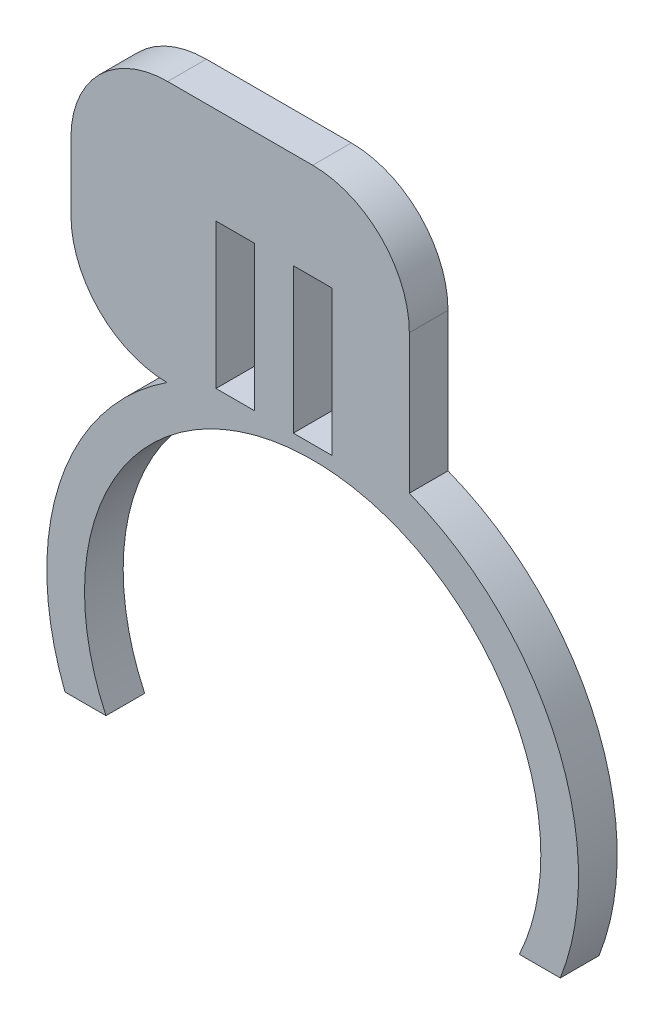
from build123d import *

# Parameters (mm, degrees)
SKETCH1_R           = 34.925
BOSS_EXTRUDE1_DEPTH = 5.08
SKETCH2_W           = 25.4
SKETCH2_H           = 5.08
BOSS_EXTRUDE2_DEPTH = 63.5
SKETCH3_R           = 29.972
CUT_EXTRUDE1_DEPTH  = 50.8
SKETCH4_W           = 5.08
SKETCH4_H           = 19.05
CUT_EXTRUDE2_DEPTH  = 50.8
SKETCH5_W           = 129.040366972
SKETCH5_H           = 73.118289239
CUT_EXTRUDE3_DEPTH  = 50.8
SKETCH6_W           = 5.08
SKETCH6_H           = 34.29
BOSS_EXTRUDE3_DEPTH = 19.05
SKETCH7_W           = 5.08
SKETCH7_H           = 19.05
CUT_EXTRUDE4_DEPTH  = 19.05
FILLET1_R           = 12.7


with BuildPart() as part:
    # Sketch1 → Boss-Extrude1 (new body)
    with BuildSketch(Plane.XY):
        Circle(SKETCH1_R)
    extrude(amount=BOSS_EXTRUDE1_DEPTH)

    # Sketch2 → Boss-Extrude2 (add)
    with BuildSketch(Plane(origin=(0, 0, 0), x_dir=(1, 0, 0), z_dir=(0, 1, 0))):
        with Locations((0, -2.54)):
            Rectangle(SKETCH2_W, SKETCH2_H)
    extrude(amount=BOSS_EXTRUDE2_DEPTH)

    # Sketch3 → Cut-Extrude1 (cut)
    with BuildSketch(Plane(origin=(0, 0, 0), x_dir=(-1, 0, 0), z_dir=(0, 0, -1))):
        Circle(SKETCH3_R)
    extrude(amount=-CUT_EXTRUDE1_DEPTH, mode=Mode.SUBTRACT)

    # Sketch4 → Cut-Extrude2 (cut)
    with BuildSketch(Plane(origin=(0, 0, 0), x_dir=(-1, 0, 0), z_dir=(0, 0, -1))):
        with Locations((0, 41.275)):
            Rectangle(SKETCH4_W, SKETCH4_H)
    extrude(amount=-CUT_EXTRUDE2_DEPTH, mode=Mode.SUBTRACT)

    # Sketch5 → Cut-Extrude3 (cut)
    with BuildSketch(Plane(origin=(0, 0, 0), x_dir=(-1, 0, 0), z_dir=(0, 0, -1))):
        with Locations((0.982448892, -49.25914462)):
            Rectangle(SKETCH5_W, SKETCH5_H)
    extrude(amount=-CUT_EXTRUDE3_DEPTH, mode=Mode.SUBTRACT)

    # Sketch6 → Boss-Extrude3 (add)
    with BuildSketch(Plane.ZY.offset(12.7)):
        with Locations((2.54, 46.355)):
            Rectangle(SKETCH6_W, SKETCH6_H)
    extrude(amount=BOSS_EXTRUDE3_DEPTH)

    # Sketch7 → Cut-Extrude4 (cut)
    with BuildSketch(Plane(origin=(0, 0, 0), x_dir=(-1, 0, 0), z_dir=(0, 0, -1))):
        with Locations((10.16, 41.275)):
            Rectangle(SKETCH7_W, SKETCH7_H)
    extrude(amount=-CUT_EXTRUDE4_DEPTH, mode=Mode.SUBTRACT)

    # Fillet1
    # the kernel refuses this fillet: 12.7 mm, written as the material it takes off along each edge
    with BuildSketch(Plane(origin=(12.7, 63.5, -31.75), x_dir=(-1, 0, 0), z_dir=(0, 0, 1))) as fillet1_piece_1:
        with BuildLine():
            CenterArc((FILLET1_R, FILLET1_R), FILLET1_R, 180, 90)
            Line((0, FILLET1_R), (0, 0))
            Line((0, 0), (FILLET1_R, 0))
        make_face()
    extrude(amount=68.58, mode=Mode.SUBTRACT)
    with BuildSketch(Plane(origin=(-31.75, 63.5, -31.75), x_dir=(1, 0, 0), z_dir=(0, 0, 1))) as fillet1_piece_2:
        with BuildLine():
            CenterArc((FILLET1_R, -FILLET1_R), FILLET1_R, 90, 90)
            Line((0, -FILLET1_R), (0, 0))
            Line((0, 0), (FILLET1_R, 0))
        make_face()
    extrude(amount=68.58, mode=Mode.SUBTRACT)
    with BuildSketch(Plane(origin=(-31.75, 29.21, 36.83), x_dir=(0, 1, 0), z_dir=(0, 0, -1))) as fillet1_piece_3_section:
        with BuildLine():
            CenterArc((FILLET1_R, FILLET1_R), FILLET1_R, 180, 90)
            Line((0, FILLET1_R), (0, 0))
            Line((0, 0), (FILLET1_R, 0))
        make_face()
    fillet1_piece_3 = extrude(amount=68.58, mode=Mode.PRIVATE)
    fillet1_piece_3 = fillet1_piece_3 - Plane(origin=(0, 0, 2.54), x_dir=(1, 0, 0), z_dir=(0, 0, -1)) * Cylinder(34.925, 188, mode=Mode.PRIVATE)
    add(fillet1_piece_3, mode=Mode.SUBTRACT)


solid = part.part
